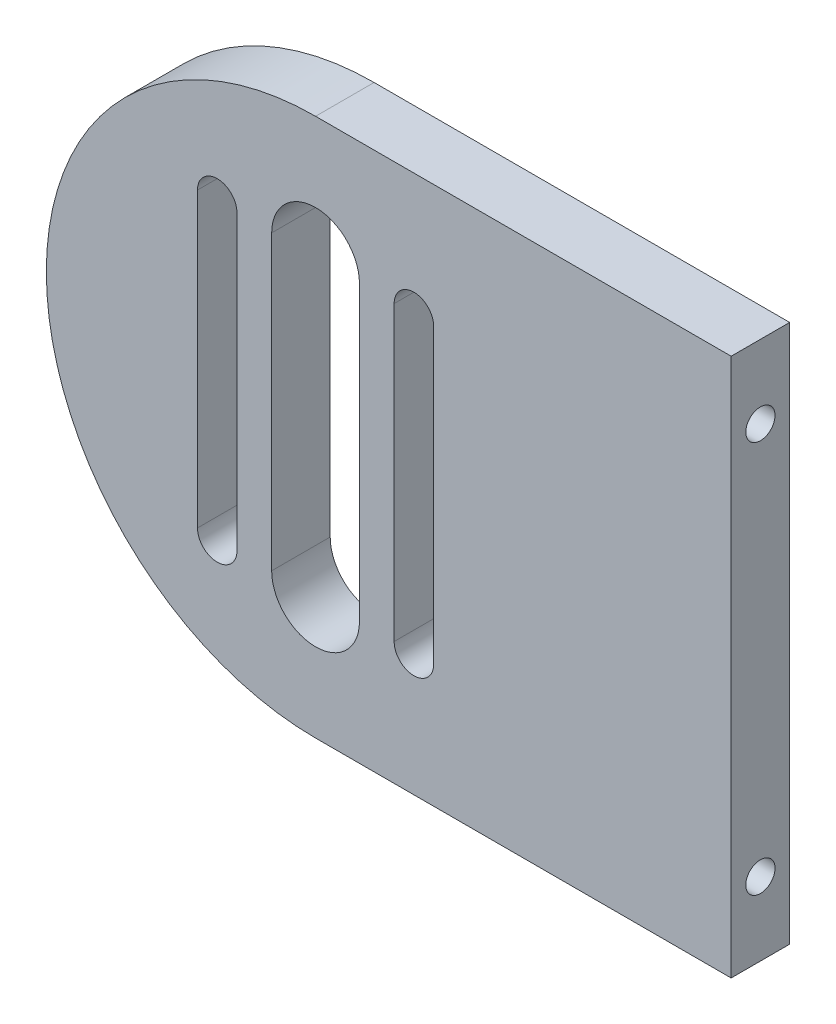
from build123d import *

# Parameters (mm, degrees)
SALIENTE_EXTRUIR1_DEPTH = 4
CROQUIS5_R              = 1
CORTAR_EXTRUIR2_DEPTH   = 8


with BuildPart() as part:
    # Croquis1 → Saliente-Extruir1 (new body)
    with BuildSketch(Plane.XY):
        with BuildLine():
            Line((28.4, 0), (28.4, 18.4))
            Line((28.4, 18.4), (0, 18.4))
            ThreePointArc((0, 18.4), (-18.4, 0), (0, -18.4))
            Line((0, -18.4), (28.4, -18.4))
            Line((28.4, -18.4), (28.4, 0))
        make_face()
        with BuildLine():
            Line((3, 0), (3, 10))
            ThreePointArc((3, 10), (0, 13), (-3, 10))
            Line((-3, 10), (-3, 0))
            Line((-3, 0), (-3, -10))
            ThreePointArc((-3, -10), (0, -13), (3, -10))
            Line((3, -10), (3, 0))
        make_face(mode=Mode.SUBTRACT)
        with BuildLine():
            Line((5.37, 0), (5.37, 10))
            ThreePointArc((5.37, 10), (6.72, 11.35), (8.07, 10))
            Line((8.07, 10), (8.07, -10))
            ThreePointArc((8.07, -10), (6.72, -11.35), (5.37, -10))
            Line((5.37, -10), (5.37, 0))
        make_face(mode=Mode.SUBTRACT)
        with BuildLine():
            Line((-8.07, 10), (-8.07, -10))
            ThreePointArc((-8.07, -10), (-6.72, -11.35), (-5.37, -10))
            Line((-5.37, -10), (-5.37, 0))
            Line((-5.37, 0), (-5.37, 10))
            ThreePointArc((-5.37, 10), (-6.72, 11.35), (-8.07, 10))
        make_face(mode=Mode.SUBTRACT)
    extrude(amount=SALIENTE_EXTRUIR1_DEPTH)

    # Croquis5 → Cortar-Extruir2 (cut)
    with BuildSketch(Plane(origin=(28.4, 0, 0), x_dir=(0, 0, -1), z_dir=(1, 0, 0))):
        with Locations((-2, 13.4)):
            Circle(CROQUIS5_R)
        with Locations((-2, -13.4)):
            Circle(CROQUIS5_R)
    extrude(amount=-CORTAR_EXTRUIR2_DEPTH, mode=Mode.SUBTRACT)


solid = part.part
